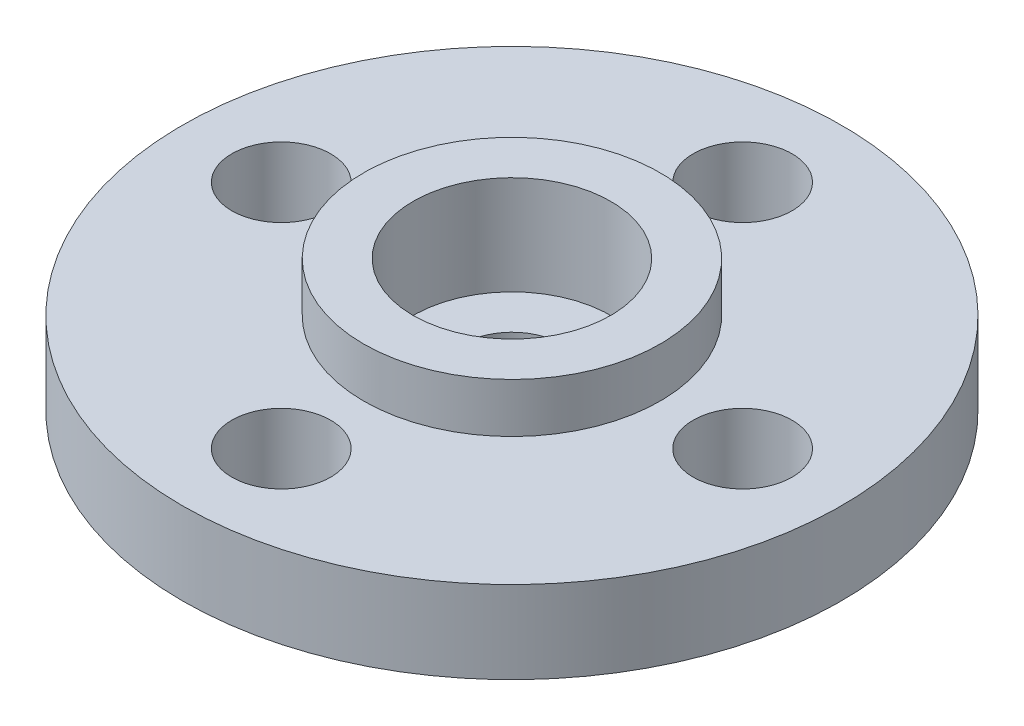
from build123d import *

# Parameters (mm, degrees)
SKETCH_1_R          = 10
SKETCH_1_R_2        = 1.5
EXTRUDE_1_DEPTH     = 2.5
SKETCH_2_R          = 4.5
SKETCH_2_R_2        = 3
EXTRUDE_2_DEPTH     = 1.5
CUT_EXTRUDE_START   = -1.5
SKETCH_3_R          = 3
CUT_EXTRUDE_1_DEPTH = 1.5


with BuildPart() as part:
    # 草图1 → 凸台-拉伸1 (new body)
    with BuildSketch(Plane(origin=(0, 0, 0), x_dir=(1, 0, 0), z_dir=(0, 1, 0))):
        Circle(SKETCH_1_R)
        Circle(SKETCH_1_R_2, mode=Mode.SUBTRACT)
        with Locations((0, 7)):
            Circle(SKETCH_1_R_2, mode=Mode.SUBTRACT)
        with Locations((7, 0)):
            Circle(SKETCH_1_R_2, mode=Mode.SUBTRACT)
        with Locations((0, -7)):
            Circle(SKETCH_1_R_2, mode=Mode.SUBTRACT)
        with Locations((-7, 0)):
            Circle(SKETCH_1_R_2, mode=Mode.SUBTRACT)
    extrude(amount=EXTRUDE_1_DEPTH)

    # 草图2 → 凸台-拉伸2 (add)
    with BuildSketch(Plane(origin=(0, 2.5, 0), x_dir=(1, 0, 0), z_dir=(0, 1, 0))):
        Circle(SKETCH_2_R)
        Circle(SKETCH_2_R_2, mode=Mode.SUBTRACT)
    extrude(amount=EXTRUDE_2_DEPTH)

    # 草图3 → 切除-拉伸1 (cut)
    with BuildSketch(Plane(origin=(0, 2.5, 0), x_dir=(1, 0, 0), z_dir=(0, 1, 0)).offset(CUT_EXTRUDE_START)):
        Circle(SKETCH_3_R)
    extrude(amount=CUT_EXTRUDE_1_DEPTH, mode=Mode.SUBTRACT)


solid = part.part
